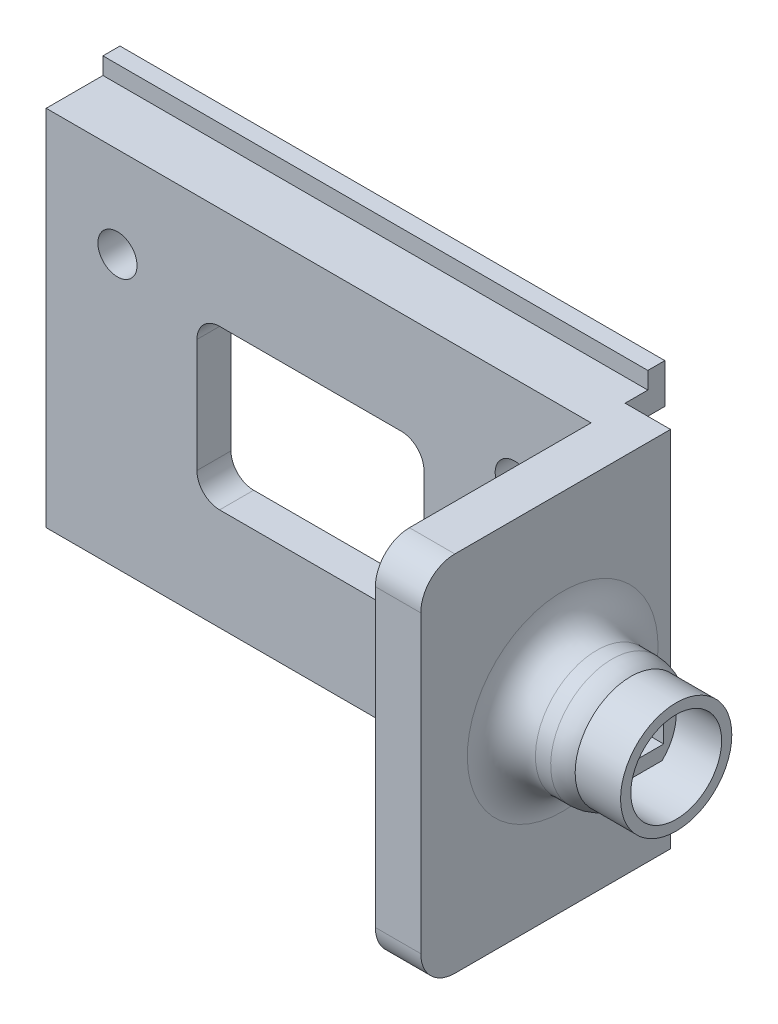
from build123d import *

# Parameters (mm, degrees)
SKETCH1_W           = 52
SKETCH1_H           = 32
BOSS_EXTRUDE1_DEPTH = 3
SKETCH2_W           = 4
SKETCH2_H           = 32
BOSS_EXTRUDE2_DEPTH = 20
FILLET1_R           = 3
SKETCH4_R           = 1.725
CUT_EXTRUDE2_DEPTH  = 3
SKETCH6_W           = 20
SKETCH6_H           = 14
CUT_EXTRUDE3_DEPTH  = 3
SKETCH7_W           = 8.2
SKETCH7_H           = 5.8
SKETCH7_W_2         = 5.8
SKETCH7_H_2         = 3.4
BOSS_EXTRUDE4_DEPTH = 6
SKETCH10_R          = 4.9
SKETCH10_R_2        = 4
BOSS_EXTRUDE6_DEPTH = 10
SKETCH8_R           = 5.4
SKETCH8_R_2         = 4.25
BOSS_EXTRUDE5_DEPTH = 6
FILLET2_R           = 2
FILLET3_R           = 3
BOSS_EXTRUDE7_DEPTH = 48


with BuildPart() as part:
    # Sketch1 → Boss-Extrude1 (new body)
    with BuildSketch(Plane.XY):
        with Locations((26, -16)):
            Rectangle(SKETCH1_W, SKETCH1_H)
    extrude(amount=BOSS_EXTRUDE1_DEPTH)

    # Sketch2 → Boss-Extrude2 (add)
    with BuildSketch(Plane(origin=(0, 0, 2), x_dir=(-1, 0, 0), z_dir=(0, 0, -1))):
        with Locations((-50, -16)):
            Rectangle(SKETCH2_W, SKETCH2_H)
    extrude(amount=-BOSS_EXTRUDE2_DEPTH)

    # Fillet1
    fillet1_edges = [part.edges().sort_by_distance(p)[0] for p in [
        (50, -32, 22),
        (50, 0, 22),
    ]]
    fillet(fillet1_edges, radius=FILLET1_R)

    # Sketch4 → Cut-Extrude2 (cut)
    with BuildSketch(Plane.XY.offset(3)):
        with Locations((41.277695867, -8)):
            Circle(SKETCH4_R)
        with Locations((6.277695867, -8)):
            Circle(SKETCH4_R)
    extrude(amount=-CUT_EXTRUDE2_DEPTH, mode=Mode.SUBTRACT)

    # Sketch6 → Cut-Extrude3 (cut)
    with BuildSketch(Plane.XY.offset(3)):
        with Locations((23.277695867, -16)):
            Rectangle(SKETCH6_W, SKETCH6_H)
    extrude(amount=-CUT_EXTRUDE3_DEPTH, mode=Mode.SUBTRACT)

    # Sketch7 → Boss-Extrude4 (add)
    with BuildSketch(Plane(origin=(52, 0, 0), x_dir=(0, 0, -1), z_dir=(1, 0, 0))):
        with Locations((-9.5, -16)):
            Rectangle(SKETCH7_W, SKETCH7_H)
        with Locations((-9.5, -16)):
            Rectangle(SKETCH7_W_2, SKETCH7_H_2, mode=Mode.SUBTRACT)
    extrude(amount=BOSS_EXTRUDE4_DEPTH)

    # Sketch10 → Boss-Extrude6 (add)
    with BuildSketch(Plane(origin=(52, 0, 0), x_dir=(0, 0, -1), z_dir=(1, 0, 0))):
        with Locations(Location((-9.5, -16, 0), (0, 0, 146.796900802))):
            Circle(SKETCH10_R)
        with Locations(Location((-9.5, -16, 0), (0, 0, 133.531152167))):
            Circle(SKETCH10_R_2, mode=Mode.SUBTRACT)
    extrude(amount=BOSS_EXTRUDE6_DEPTH)

    # Sketch8 → Boss-Extrude5 (add)
    with BuildSketch(Plane(origin=(52, 0, 0), x_dir=(0, 0, -1), z_dir=(1, 0, 0))):
        with Locations(Location((-9.5, -16, 0), (0, 0, 270))):
            Circle(SKETCH8_R)
        with Locations((-9.5, -16)):
            Circle(SKETCH8_R_2, mode=Mode.SUBTRACT)
    extrude(amount=BOSS_EXTRUDE5_DEPTH)

    # Fillet2
    fillet2_edges = [part.edges().sort_by_distance(p)[0] for p in [
        (33.277695867, -9, 1.5),
        (33.277695867, -23, 1.5),
        (13.277695867, -23, 1.5),
        (13.277695867, -9, 1.5),
    ]]
    fillet(fillet2_edges, radius=FILLET2_R)

    # Fillet3
    # the kernel refuses this fillet: 3 mm, written as the material it adds along each edge
    with BuildSketch(Plane(origin=(52, -16, 9.5), x_dir=(0, -1, 0), z_dir=(0, 0, 1))) as fillet3_piece_1:
        with BuildLine():
            CenterArc((5.4 + FILLET3_R, FILLET3_R), FILLET3_R, 180, 90)
            Line((5.4, FILLET3_R), (5.4, 0))
            Line((5.4, 0), (5.4 + FILLET3_R, 0))
        make_face()
    revolve(axis=Axis((52, -16, 9.5), (1, 0, 0)))
    # the kernel refuses this fillet: 3 mm, written as the material it takes off along each edge
    with BuildSketch(Plane(origin=(58, -16, 9.5), x_dir=(0, -1, 0), z_dir=(0, 0, 1))) as fillet3_2_piece_1:
        with BuildLine():
            CenterArc((2.4, -1.658312395), FILLET3_R, 0, 33.557309762)
            Line((4.9, 0), (5.4, 0))
            Line((5.4, 0), (5.4, -1.658312395))
        make_face()
    revolve(axis=Axis((58, -16, 9.5), (1, 0, 0)), mode=Mode.SUBTRACT)

    # Sketch15 → Boss-Extrude7 (add)
    with BuildSketch(Plane.ZY):
        Polygon((-3.5, -2), (-3.5, 1.5), (-2, 1.5), (-2, 0), (0, 0), (0, -2), align=None)
        Polygon((-3.5, -33.5), (-2, -33.5), (-2, -32), (0, -32), (0, -30), (-3.5, -30), align=None)
    extrude(amount=-BOSS_EXTRUDE7_DEPTH)


solid = part.part
